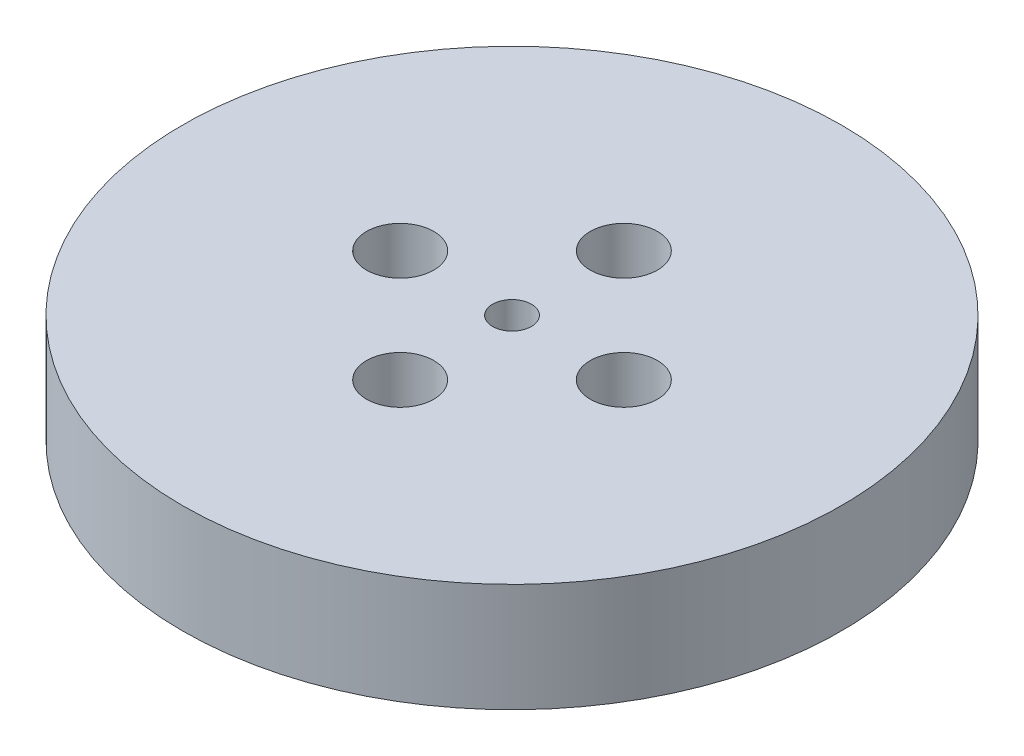
from build123d import *

# Parameters (mm, degrees)
SKETCH1_R           = 85
BOSS_EXTRUDE1_DEPTH = 28
SKETCH2_R           = 5
CUT_EXTRUDE1_DEPTH  = 124.426091245
SKETCH3_R           = 8.666851531
CUT_EXTRUDE2_DEPTH  = 18.669472941
CIRPATTERN1_COUNT   = 4


with BuildPart() as part:
    # Sketch1 → Boss-Extrude1 (new body)
    with BuildSketch(Plane(origin=(0, 0, 0), x_dir=(1, 0, 0), z_dir=(0, 1, 0))):
        Circle(SKETCH1_R)
    extrude(amount=BOSS_EXTRUDE1_DEPTH)

    # Sketch2 → Cut-Extrude1 (cut, through all)
    with BuildSketch(Plane(origin=(0, 0, 0), x_dir=(1, 0, 0), z_dir=(0, 1, 0))):
        Circle(SKETCH2_R)
    extrude(amount=CUT_EXTRUDE1_DEPTH, mode=Mode.SUBTRACT)

    # Sketch3 → Cut-Extrude2 (cut)
    with BuildSketch(Plane(origin=(0, 28, 0), x_dir=(1, 0, 0), z_dir=(0, 1, 0))):
        with Locations((-28.843617094, 0)):
            Circle(SKETCH3_R)
    cut_extrude2 = extrude(amount=-CUT_EXTRUDE2_DEPTH, mode=Mode.SUBTRACT)

    # CirPattern1: Cut-Extrude2 ×4 about axis
    cirpattern1_axis = Axis((0, 0, 0), (0, 1, 0))
    for i in range(1, CIRPATTERN1_COUNT):
        add(cut_extrude2.rotate(cirpattern1_axis, i * 360 / CIRPATTERN1_COUNT), mode=Mode.SUBTRACT)


solid = part.part
